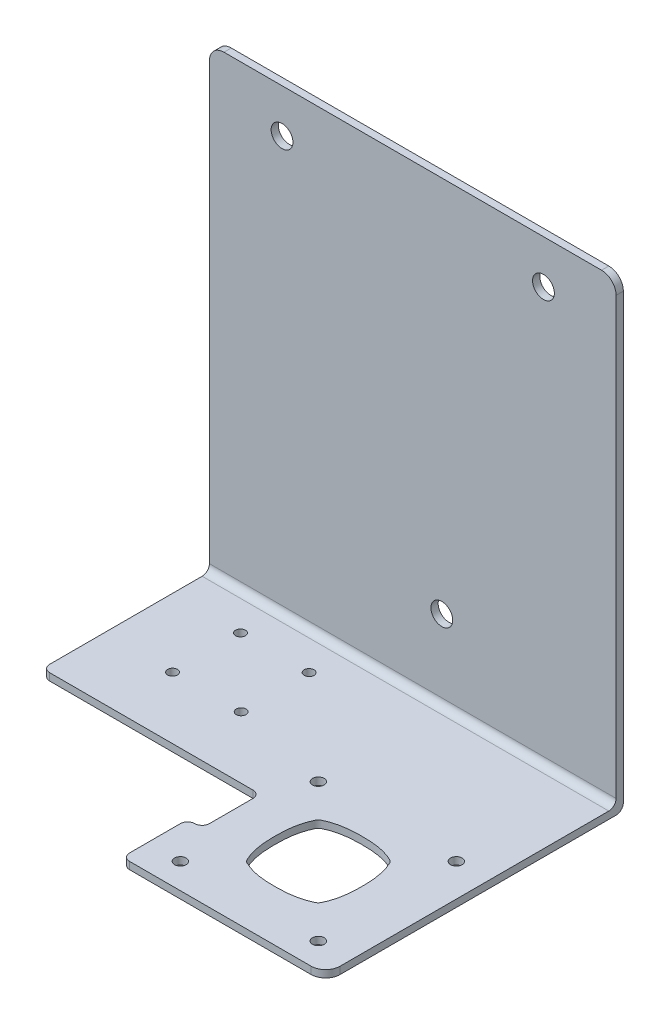
from build123d import *

# Parameters (mm, degrees)
SKETCH2_W               = 177.8
SKETCH2_H               = 203.2
BOSS_EXTRUDE1_DEPTH     = 3.175
SKETCH3_W               = 177.8
SKETCH3_H               = 3.175
BOSS_EXTRUDE2_DEPTH     = 127
FILLET1_R               = 3.175
FILLET2_R               = 6.35
CUT_EXTRUDE1_DEPTH      = 255.673793803
CUT_EXTRUDE1_DEPTH_BACK = 255.673793803
FILLET4_R               = 3.175
SKETCH6_R               = 2.54
SKETCH6_R_2             = 2.15
CUT_EXTRUDE2_DEPTH      = 255.673793803
SKETCH7_R               = 4.7625
CUT_EXTRUDE3_DEPTH      = 186.350397895
CUT_EXTRUDE4_DEPTH      = 255.673793803


with BuildPart() as part:
    # Sketch2 → Boss-Extrude1 (new body)
    with BuildSketch(Plane.XY):
        Rectangle(SKETCH2_W, SKETCH2_H)
    extrude(amount=BOSS_EXTRUDE1_DEPTH)

    # Sketch3 → Boss-Extrude2 (add)
    with BuildSketch(Plane.XY.offset(3.175)):
        with Locations((0, -100.0125)):
            Rectangle(SKETCH3_W, SKETCH3_H)
    extrude(amount=BOSS_EXTRUDE2_DEPTH)

    # Fillet1
    fillet1_edges = [part.edges().sort_by_distance(p)[0] for p in [
        (0, -98.425, 3.175),
        (0, -101.6, 0),
    ]]
    fillet(fillet1_edges, radius=FILLET1_R)

    # Fillet2
    fillet2_edges = [part.edges().sort_by_distance(p)[0] for p in [
        (-88.9, -100.0125, 130.175),
        (88.9, -100.0125, 130.175),
        (-88.9, 101.6, 1.5875),
        (88.9, 101.6, 1.5875),
    ]]
    fillet(fillet2_edges, radius=FILLET2_R)

    # Sketch5 → Cut-Extrude1 (cut, two sides: drawn at the far end of the back side and taken through both)
    with BuildSketch(Plane(origin=(0, -98.425, 0), x_dir=(1, 0, 0), z_dir=(0, 1, 0)).offset(-CUT_EXTRUDE1_DEPTH_BACK)):
        Polygon((-485.781273778, -76.2), (-88.9, -76.2), (6.35, -76.2), (6.35, -101.6), (0, -101.6), (0, -130.175), (0, -527.056273778), (-539.971017798, -1108.855450333), (-1025.752291576, -657.999176556), align=None)
    extrude(amount=CUT_EXTRUDE1_DEPTH + CUT_EXTRUDE1_DEPTH_BACK, mode=Mode.SUBTRACT)

    # Fillet4
    fillet4_edges = [part.edges().sort_by_distance(p)[0] for p in [
        (6.35, -100.0125, 101.6),
        (-88.9, -100.0125, 76.2),
        (0, -100.0125, 130.175),
        (0, -100.0125, 101.6),
        (6.35, -100.0125, 76.2),
    ]]
    fillet(fillet4_edges, radius=FILLET4_R - 0.0001)  # a hair under: the kernel refuses the full size

    # Sketch6 → Cut-Extrude2 (cut, through all)
    with BuildSketch(Plane(origin=(0, -98.425, 0), x_dir=(1, 0, 0), z_dir=(0, 1, 0))):
        with Locations(Location((74.6125, -119.0625, 0), (0, 0, 270))):
            Circle(SKETCH6_R)
        with Locations(Location((14.2875, -119.0625, 0), (0, 0, 270))):
            Circle(SKETCH6_R)
        with Locations(Location((14.2875, -58.7375, 0), (0, 0, 270))):
            Circle(SKETCH6_R)
        with Locations(Location((74.6125, -58.7375, 0), (0, 0, 270))):
            Circle(SKETCH6_R)
        with Locations(Location((-29.05, -49.140037229, 0), (0, 0, 270))):
            Circle(SKETCH6_R_2)
        with Locations(Location((-59.05, -49.140037229, 0), (0, 0, 270))):
            Circle(SKETCH6_R_2)
        with Locations(Location((-29.05, -19.440037229, 0), (0, 0, 270))):
            Circle(SKETCH6_R_2)
        with Locations(Location((-59.05, -19.440037229, 0), (0, 0, 270))):
            Circle(SKETCH6_R_2)
    extrude(amount=-CUT_EXTRUDE2_DEPTH, mode=Mode.SUBTRACT)

    # Sketch7 → Cut-Extrude3 (cut, through all)
    with BuildSketch(Plane.XY.offset(3.175)):
        with Locations((-57.15, 82.55)):
            Circle(SKETCH7_R)
        with Locations((57.15, 82.55)):
            Circle(SKETCH7_R)
        with Locations((12.7, -63.5)):
            Circle(SKETCH7_R)
    extrude(amount=-CUT_EXTRUDE3_DEPTH, mode=Mode.SUBTRACT)

    # Sketch8 → Cut-Extrude4 (cut, through all)
    with BuildSketch(Plane(origin=(0, -98.425, 0), x_dir=(1, 0, 0), z_dir=(0, 1, 0))):
        with BuildLine():
            add(Edge.make_bspline(
                [(59.248488812, -105.191004458), (54.640123193, -107.455311414), (44.45, -108.444688585), (33.894314939, -107.419818363), (28.664595213, -104.685404787), (25.930181637, -99.455685061), (24.905311414, -88.9), (25.930181637, -78.344314939), (28.664595213, -73.114595213), (33.894314939, -70.380181637), (44.45, -69.355311414), (55.005685061, -70.380181637), (60.235404787, -73.114595213), (62.969818363, -78.344314939), (63.994688585, -88.9), (62.969818363, -99.455685061), (60.235404787, -104.685404787), (59.579131084, -105.028544346), (59.248488812, -105.191004458)],
                knots=[0, 0, 0, 0, 0.116631865, 0.23326373, 0.241631865, 0.25, 0.366631865, 0.48326373, 0.491631865, 0.5, 0.616631865, 0.73326373, 0.741631865, 0.75, 0.866631865, 0.98326373, 0.991631865, 1, 1, 1, 1], degree=3))
        make_face()
    extrude(amount=-CUT_EXTRUDE4_DEPTH, mode=Mode.SUBTRACT)


solid = part.part
